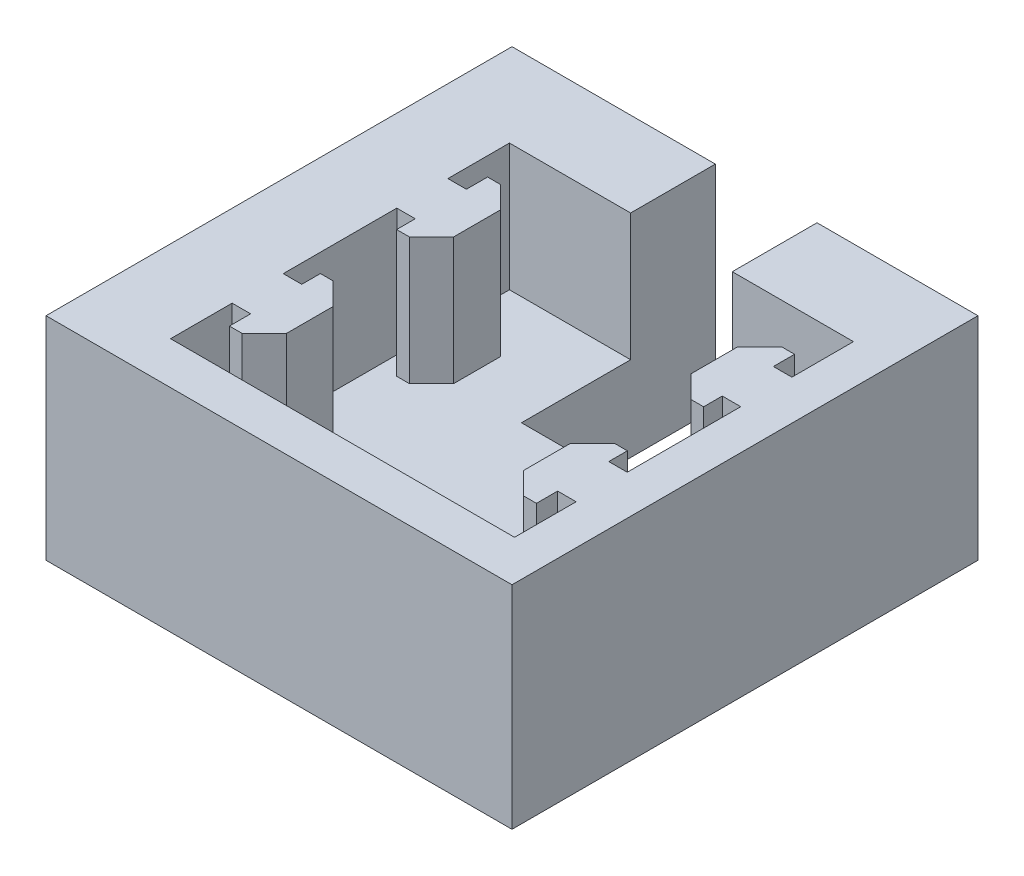
from build123d import *

# Parameters (mm, degrees)
SKETCH1_W           = 55
SKETCH1_H           = 55
BOSS_EXTRUDE1_DEPTH = 10
BOSS_EXTRUDE3_DEPTH = 15
SKETCH3_W           = 55
SKETCH3_H           = 55
SKETCH3_W_2         = 40.6
SKETCH3_H_2         = 40
BOSS_EXTRUDE5_DEPTH = 15
SKETCH7_W           = 12
SKETCH7_H           = 22.88370491
CUT_EXTRUDE3_DEPTH  = 45
SKETCH8_R           = 2
CUT_EXTRUDE4_DEPTH  = 7
SKETCH9_R           = 2
CUT_EXTRUDE5_DEPTH  = 7


with BuildPart() as part:
    # Sketch1 → Boss-Extrude1 (new body)
    with BuildSketch(Plane(origin=(0, 0, 0), x_dir=(1, 0, 0), z_dir=(0, 1, 0))):
        with Locations((-27.5, -27.5)):
            Rectangle(SKETCH1_W, SKETCH1_H)
    extrude(amount=BOSS_EXTRUDE1_DEPTH)

    # Sketch2 → Boss-Extrude3 (add)
    with BuildSketch(Plane(origin=(0, 10, 0), x_dir=(1, 0, 0), z_dir=(0, 1, 0))):
        Polygon((-45.31629509, -17.267409819), (-43.11629509, -17.267409819), (-43.11629509, -14.767409819), (-41.61629509, -14.767409819), (-39, -17.38370491), (-39, -22.88370491), (-41.61629509, -25.5), (-43.11629509, -25.5), (-43.11629509, -23.3), (-45.31629509, -23.3), align=None)
        Polygon((-6.88370491, -23.3), (-4.68370491, -23.3), (-4.68370491, -17.267409819), (-6.88370491, -17.267409819), (-6.88370491, -14.767409819), (-8.38370491, -14.767409819), (-11, -17.38370491), (-11, -22.88370491), (-8.38370491, -25.5), (-6.88370491, -25.5), align=None)
        Polygon((-43.11629509, -36.7), (-45.31629509, -36.7), (-45.31629509, -42.732590181), (-43.11629509, -42.732590181), (-43.11629509, -45.232590181), (-41.61629509, -45.232590181), (-39, -42.61629509), (-39, -37.11629509), (-41.61629509, -34.5), (-43.11629509, -34.5), align=None)
        Polygon((-6.88370491, -34.5), (-6.88370491, -36.7), (-4.68370491, -36.7), (-4.68370491, -42.732590181), (-6.88370491, -42.732590181), (-6.88370491, -45.232590181), (-8.38370491, -45.232590181), (-11, -42.61629509), (-11, -37.11629509), (-8.38370491, -34.5), align=None)
    extrude(amount=BOSS_EXTRUDE3_DEPTH)

    # Sketch3 → Boss-Extrude5 (add)
    with BuildSketch(Plane(origin=(0, 10, 0), x_dir=(1, 0, 0), z_dir=(0, 1, 0))):
        with Locations((-27.5, -27.5)):
            Rectangle(SKETCH3_W, SKETCH3_H)
        with Locations((-25, -30)):
            Rectangle(SKETCH3_W_2, SKETCH3_H_2, mode=Mode.SUBTRACT)
    extrude(amount=BOSS_EXTRUDE5_DEPTH)

    # Sketch7 → Cut-Extrude3 (cut)
    with BuildSketch(Plane(origin=(0, 25, 0), x_dir=(1, 0, 0), z_dir=(0, 1, 0))):
        with Locations((-25, -11.441852455)):
            Rectangle(SKETCH7_W, SKETCH7_H)
    extrude(amount=-CUT_EXTRUDE3_DEPTH, mode=Mode.SUBTRACT)

    # Sketch8 → Cut-Extrude4 (cut)
    with BuildSketch(Plane(origin=(0, 0, 0), x_dir=(-1, 0, 0), z_dir=(0, 0, -1))):
        with Locations((50, 9)):
            Circle(SKETCH8_R)
    extrude(amount=-CUT_EXTRUDE4_DEPTH, mode=Mode.SUBTRACT)

    # Sketch9 → Cut-Extrude5 (cut)
    with BuildSketch(Plane.XZ):
        with Locations((-40, 43)):
            Circle(SKETCH9_R)
        with Locations((-50, 43)):
            Circle(SKETCH9_R)
    extrude(amount=-CUT_EXTRUDE5_DEPTH, mode=Mode.SUBTRACT)


solid = part.part
